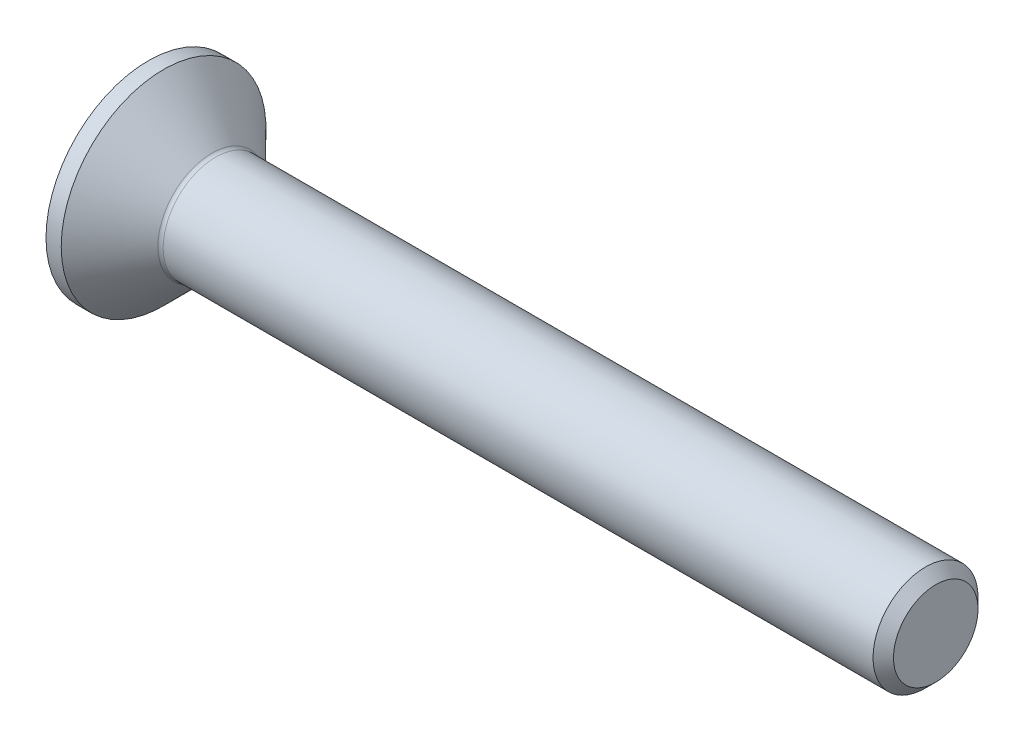
from build123d import *

# Parameters (mm, degrees)
FILLET1_R   = 0.2
HEX_START   = -1.5
HEX_2_DEPTH = 1.5


with BuildPart() as part:
    # BodySke → BaseBody (revolve)
    with BuildSketch(Plane.XY, mode=Mode.PRIVATE) as basebody_sk:
        Polygon((0, 0), (0, 3.9), (0.58, 3.9), (2.48, 2), (29.61, 2), (30, 1.61), (30, 0), align=None)
    revolve(basebody_sk.sketch.rotate(Axis((0, 0, 0), (1, 0, 0)), 90), axis=Axis((0, 0, 0), (1, 0, 0)))

    # Fillet1
    fillet1_edges = [part.edges().sort_by_distance(p)[0] for p in [
        (2.48, 0, -2),
    ]]
    fillet(fillet1_edges, radius=FILLET1_R)

    # Hex 2: read off the stored shape, not the designer's step
    # Hex 2 outline → Hex 2 (cut)
    with BuildSketch(Plane.ZY.offset(HEX_START)):
        Polygon((-1.25, -0.721687836), (0, -1.443375673), (1.25, -0.721687836), (1.25, 0.721687836), (0, 1.443375673), (-1.25, 0.721687836), align=None)
    extrude(amount=HEX_2_DEPTH, mode=Mode.SUBTRACT)

    # Hex 2 2 outline → Hex 2 2 (revolve, cut)
    with BuildSketch(Plane.YX):
        Polygon((1.25, 1.5), (0, 2.221687836), (0, 1.5), align=None)
    revolve(axis=Axis((0, 0, 0), (1, 0, 0)), mode=Mode.SUBTRACT)


solid = part.part
